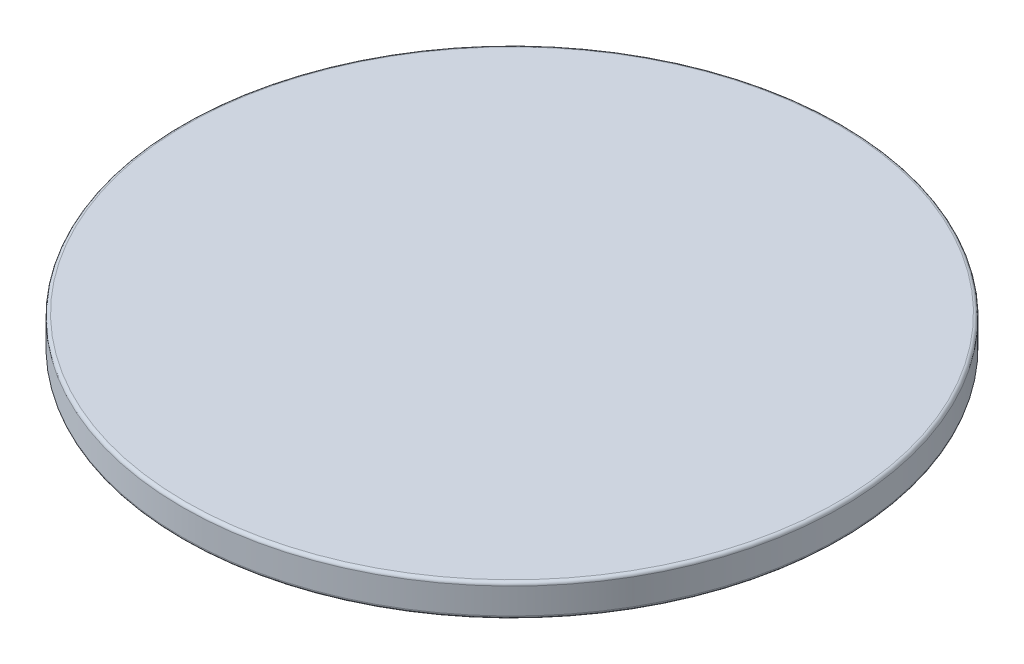
from build123d import *

# Parameters (mm, degrees)
SKETCH2_R           = 64.77
BOSS_EXTRUDE1_DEPTH = 6.35
FILLET1_R           = 0.635


with BuildPart() as part:
    # Sketch2 → Boss-Extrude1 (new body)
    with BuildSketch(Plane(origin=(0, 0, 0), x_dir=(1, 0, 0), z_dir=(0, 1, 0))):
        Circle(SKETCH2_R)
    extrude(amount=BOSS_EXTRUDE1_DEPTH)

    # Fillet1
    fillet1_edges = [part.edges().sort_by_distance(p)[0] for p in [
        (-64.77, 0, 0),
        (-64.77, 6.35, 0),
    ]]
    fillet(fillet1_edges, radius=FILLET1_R)


solid = part.part
